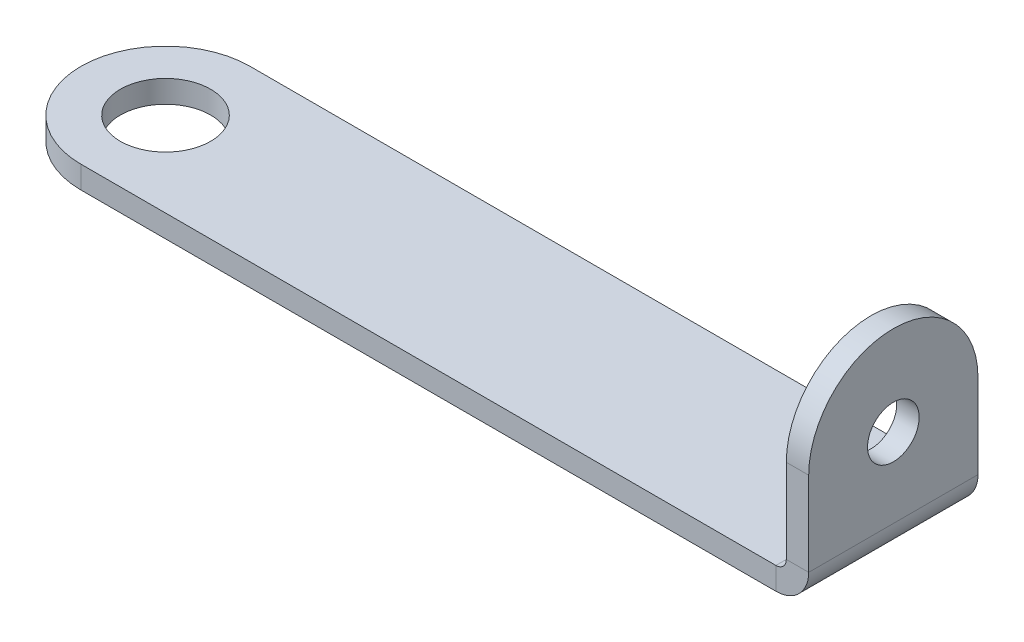
from build123d import *

# Parameters (mm, degrees)
SKETCH1_R                    = 3.2
BASE_FLANGE1_DEPTH           = 1.5875
EDGE_FLANGE1_STRIP_W         = 7.8232
EDGE_FLANGE1_STRIP_H         = 1.5875
EDGE_FLANGE1_STRIP_CUT_DEPTH = 12
EDGE_FLANGE1_DEPTH           = 12
HOLE1_START                  = 50
HOLE1_OUTLINE_R              = 1.8288
HOLE1_DEPTH                  = 1.5875
FILLET1_RADIUS               = 6
FILLET1_LENGTH               = 1.5875


# Read off the part's stored shape, not the designer's step: Hole1
# Sheet-metal steps are written as plain solids
with BuildPart() as part:
    # Sketch1 → Base-Flange1 (new body)
    with BuildSketch(Plane(origin=(0, 0, 0), x_dir=(1, 0, 0), z_dir=(0, 1, 0))):
        with BuildLine():
            Line((0, 6), (50, 6))
            Line((50, 6), (50, -6))
            Line((50, -6), (0, -6))
            ThreePointArc((0, -6), (-6, 0), (0, 6))
        make_face()
        with Locations(Location((0, 0, 0), (0, 0, 270))):
            Circle(SKETCH1_R, mode=Mode.SUBTRACT)
    extrude(amount=BASE_FLANGE1_DEPTH)

    # Edge-Flange1 strip (across the edge) → Edge-Flange1 strip cut (cut)
    with BuildSketch(Plane(origin=(50, 1.5875, 6), x_dir=(-1, 0, 0), z_dir=(0, 0, -1))):
        with Locations((-3.175, -0.79375)):
            Rectangle(EDGE_FLANGE1_STRIP_W, EDGE_FLANGE1_STRIP_H)
    extrude(amount=EDGE_FLANGE1_STRIP_CUT_DEPTH, mode=Mode.SUBTRACT)

    # Edge-Flange1 section (across the edge) → Edge-Flange1 (add)
    with BuildSketch(Plane(origin=(50, 1.5875, 6), x_dir=(-1, 0, 0), z_dir=(0, 0, -1))):
        with BuildLine():
            Line((-1.5875, 0.7366), (-1.5875, 12.7))
            Line((-1.5875, 12.7), (0, 12.7))
            Line((0, 12.7), (0, 0.7366))
            ThreePointArc((0, 0.7366), (0.215745145, 0.215745145), (0.7366, 0))
            Line((0.7366, 0), (0.7366, -1.5875))
            ThreePointArc((0.7366, -1.5875), (-0.90678687, -0.90678687), (-1.5875, 0.7366))
        make_face()
    extrude(amount=EDGE_FLANGE1_DEPTH)

    # Hole1 outline → Hole1 (cut)
    with BuildSketch(Plane.YZ.offset(HOLE1_START)):
        with Locations((7.9375, 0)):
            Circle(HOLE1_OUTLINE_R)
    extrude(amount=HOLE1_DEPTH, mode=Mode.SUBTRACT)

    # Fillet1: full round fillet: the end face becomes a half cylinder, R = half its width
    fillet1_face = Plane((50.79375, 14.2875, 0), x_dir=(1, 0, 0), z_dir=(0, 1, 0))  # on the end face: x along it, z out of the body
    fillet1_slab = fillet1_face.offset(-FILLET1_RADIUS / 2) * Box(FILLET1_LENGTH, 2 * FILLET1_RADIUS, FILLET1_RADIUS, mode=Mode.PRIVATE)  # the body's end, R deep
    fillet1_round = Plane((50.79375, 8.2875, 0), x_dir=(0, 1, 0), z_dir=(1, 0, 0)) * Cylinder(FILLET1_RADIUS, FILLET1_LENGTH, mode=Mode.PRIVATE)  # its axis R under the face
    add(fillet1_slab - fillet1_round, mode=Mode.SUBTRACT)


solid = part.part
